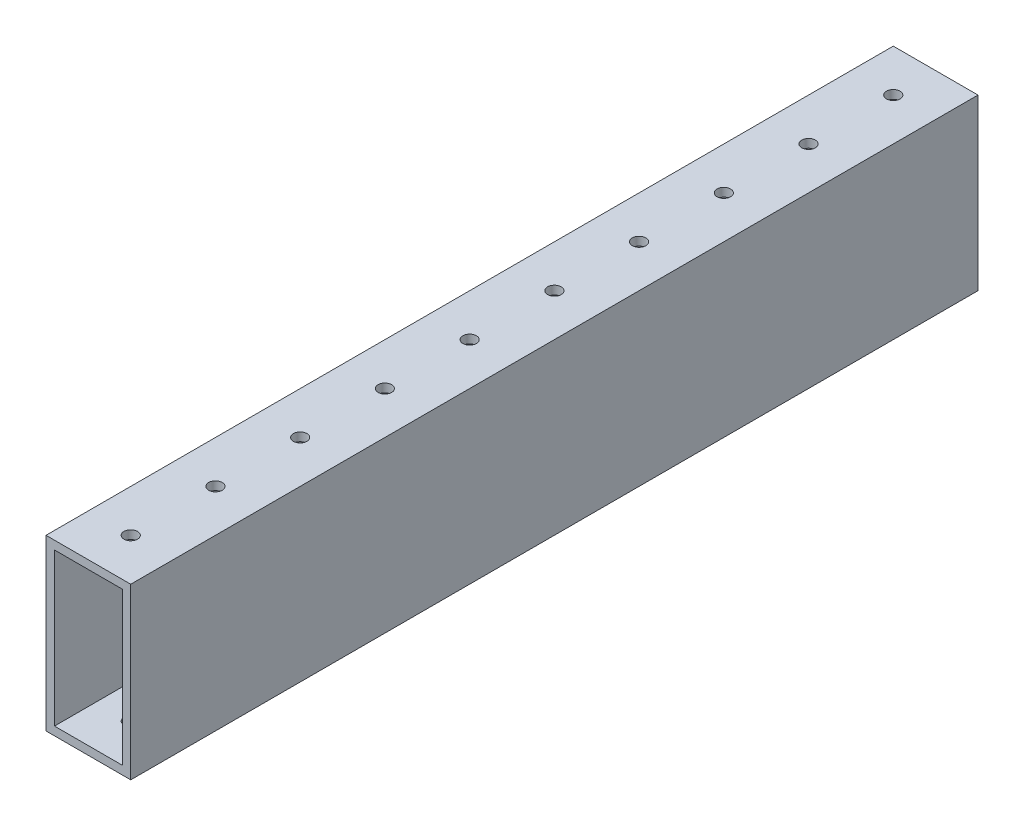
from build123d import *

# Parameters (mm, degrees)
SKETCH1_W           = 25.4
SKETCH1_H           = 50.8
SKETCH1_W_2         = 20.32
SKETCH1_H_2         = 45.72
BOSS_EXTRUDE1_DEPTH = 254
SKETCH2_R           = 2.032
CUT_EXTRUDE1_DEPTH  = 260.34133878


with BuildPart() as part:
    # Sketch1 → Boss-Extrude1 (new body)
    with BuildSketch(Plane.XY):
        Rectangle(SKETCH1_W, SKETCH1_H)
        Rectangle(SKETCH1_W_2, SKETCH1_H_2, mode=Mode.SUBTRACT)
    extrude(amount=-BOSS_EXTRUDE1_DEPTH)

    # Sketch2 → Cut-Extrude1 (cut, through all)
    with BuildSketch(Plane(origin=(0, 25.4, 0), x_dir=(1, 0, 0), z_dir=(0, 1, 0))):
        with Locations((0, 12.7)):
            Circle(SKETCH2_R)
        with Locations((0, 38.1)):
            Circle(SKETCH2_R)
        with Locations((0, 63.5)):
            Circle(SKETCH2_R)
        with Locations((0, 88.9)):
            Circle(SKETCH2_R)
        with Locations((0, 114.3)):
            Circle(SKETCH2_R)
        with Locations((0, 139.7)):
            Circle(SKETCH2_R)
        with Locations((0, 165.1)):
            Circle(SKETCH2_R)
        with Locations((0, 190.5)):
            Circle(SKETCH2_R)
        with Locations((0, 215.9)):
            Circle(SKETCH2_R)
        with Locations((0, 241.3)):
            Circle(SKETCH2_R)
        with Locations((0, 266.7)):
            Circle(SKETCH2_R)
        with Locations((0, 292.1)):
            Circle(SKETCH2_R)
        with Locations((0, 317.5)):
            Circle(SKETCH2_R)
        with Locations((0, 342.9)):
            Circle(SKETCH2_R)
        with Locations((0, 368.3)):
            Circle(SKETCH2_R)
        with Locations((0, 393.7)):
            Circle(SKETCH2_R)
        with Locations((0, 419.1)):
            Circle(SKETCH2_R)
        with Locations((0, 444.5)):
            Circle(SKETCH2_R)
        with Locations((0, 469.9)):
            Circle(SKETCH2_R)
        with Locations((0, 495.3)):
            Circle(SKETCH2_R)
        with Locations((0, 520.7)):
            Circle(SKETCH2_R)
        with Locations((0, 546.1)):
            Circle(SKETCH2_R)
        with Locations((0, 571.5)):
            Circle(SKETCH2_R)
        with Locations((0, 596.9)):
            Circle(SKETCH2_R)
        with Locations((0, 622.3)):
            Circle(SKETCH2_R)
        with Locations((0, 647.7)):
            Circle(SKETCH2_R)
        with Locations((0, 673.1)):
            Circle(SKETCH2_R)
        with Locations((0, 698.5)):
            Circle(SKETCH2_R)
        with Locations((0, 723.9)):
            Circle(SKETCH2_R)
        with Locations((0, 749.3)):
            Circle(SKETCH2_R)
    extrude(amount=-CUT_EXTRUDE1_DEPTH, mode=Mode.SUBTRACT)


solid = part.part
